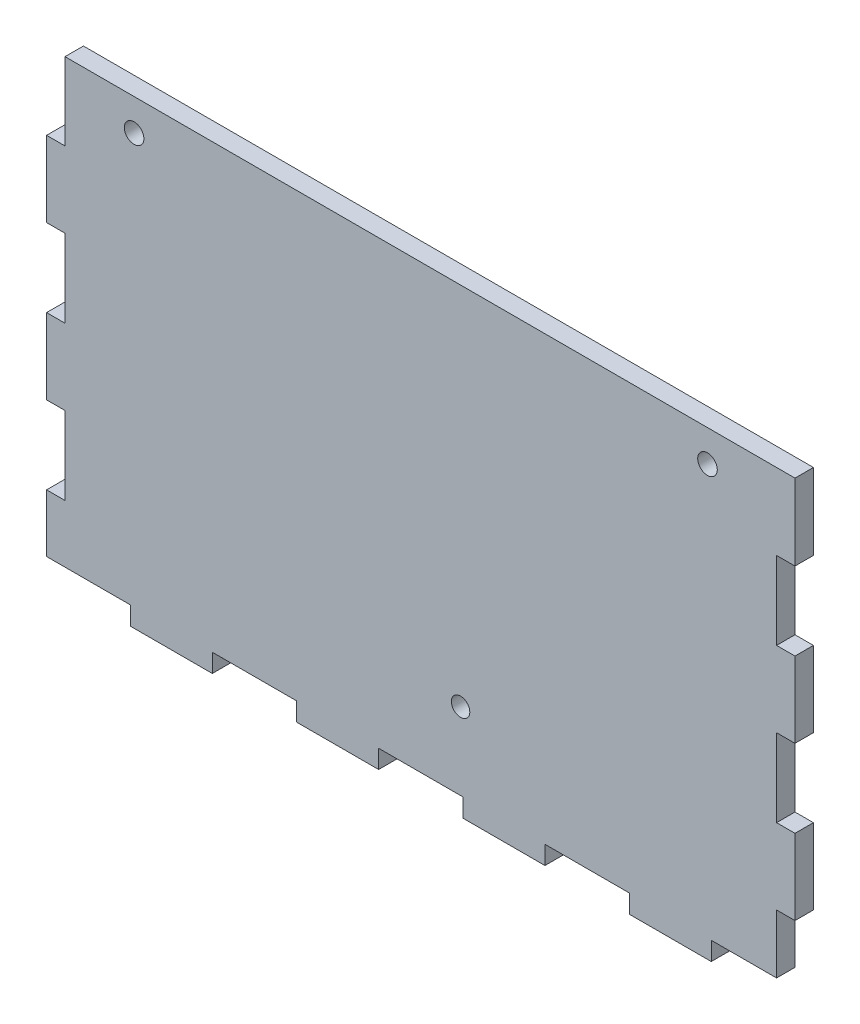
from build123d import *

# Parameters (mm, degrees)
SKETCH1_W                = 130
SKETCH1_H                = 80
BOSS_EXTRUDE1_DEPTH      = 3.2
SKETCH2_W                = 14.444444444
SKETCH2_H                = 3.2
SKETCH2_W_2              = 3.2
SKETCH2_H_2              = 13.333333334
SKETCH2_H_3              = 13.333333333
CUT_EXTRUDE1_DEPTH       = 153.676913775
CUT_EXTRUDE2_REACH       = 154.677
SKETCH3_R                = 1.7
TUNING_DRIVER_HOLE_REACH = 154.677
SKETCH4_R                = 1.6
WIDTH_TOLERANCE_BY       = 0.1
WIDTH_TOLERANCE_2_BY     = 0.1
WIDTH_TOLERANCE_3_BY     = 0.1
WIDTH_TOLERANCE_4_BY     = 0.1
WIDTH_TOLERANCE_5_BY     = 0.1
WIDTH_TOLERANCE_6_BY     = 0.1
WIDTH_TOLERANCE_7_BY     = 0.1
WIDTH_TOLERANCE_8_BY     = 0.1
WIDTH_TOLERANCE_9_BY     = 0.1
WIDTH_TOLERANCE_10_BY    = 0.1
WIDTH_TOLERANCE_11_BY    = 0.1
WIDTH_TOLERANCE_12_BY    = 0.1
WIDTH_TOLERANCE_13_BY    = 0.1
WIDTH_TOLERANCE_14_BY    = 0.1
WIDTH_TOLERANCE_15_BY    = 0.1
WIDTH_TOLERANCE_16_BY    = 0.1
WIDTH_TOLERANCE_17_BY    = 0.1
WIDTH_TOLERANCE_18_BY    = 0.1


with BuildPart() as part:
    # Sketch1 → Boss-Extrude1 (new body)
    with BuildSketch(Plane.XY):
        with Locations((65, 40)):
            Rectangle(SKETCH1_W, SKETCH1_H)
    extrude(amount=BOSS_EXTRUDE1_DEPTH)

    # Sketch2 → Cut-Extrude1 (cut, through all)
    with BuildSketch(Plane.XY.offset(3.2)):
        with Locations((7.222222222, 1.6)):
            Rectangle(SKETCH2_W, SKETCH2_H)
        with Locations((36.111111111, 1.6)):
            Rectangle(SKETCH2_W, SKETCH2_H)
        with Locations((65, 1.6)):
            Rectangle(SKETCH2_W, SKETCH2_H)
        with Locations((93.888888889, 1.6)):
            Rectangle(SKETCH2_W, SKETCH2_H)
        Polygon((115.555555556, 0), (115.555555556, 3.2), (126.8, 3.2), (126.8, 13.333333333), (130, 13.333333333), (130, 0), align=None)
        with Locations((1.6, 20)):
            Rectangle(SKETCH2_W_2, SKETCH2_H_2)
        with Locations((1.6, 46.666666667)):
            Rectangle(SKETCH2_W_2, SKETCH2_H_3)
        with Locations((1.6, 73.333333334)):
            Rectangle(SKETCH2_W_2, SKETCH2_H_3)
        with Locations((128.4, 33.333333334)):
            Rectangle(SKETCH2_W_2, SKETCH2_H_3)
        with Locations((128.4, 60)):
            Rectangle(SKETCH2_W_2, SKETCH2_H_2)
    extrude(amount=-CUT_EXTRUDE1_DEPTH, mode=Mode.SUBTRACT)

    # Sketch3 → Cut-Extrude2 (cut, up to next)
    with BuildSketch(Plane.XY.offset(3.2), mode=Mode.PRIVATE) as cut_extrude2_sk1:
        with Locations((15.2, 74.5)):
            Circle(SKETCH3_R)
    cut_extrude2_tool1 = extrude(cut_extrude2_sk1.sketch, amount=-CUT_EXTRUDE2_REACH, mode=Mode.PRIVATE) & part.part
    # Sketch3 → Cut-Extrude2 (cut, up to next)
    with BuildSketch(Plane.XY.offset(3.2), mode=Mode.PRIVATE) as cut_extrude2_sk2:
        with Locations((114.8, 74.5)):
            Circle(SKETCH3_R)
    cut_extrude2_tool2 = extrude(cut_extrude2_sk2.sketch, amount=-CUT_EXTRUDE2_REACH, mode=Mode.PRIVATE) & part.part
    add(cut_extrude2_tool1.solids().sort_by_distance((15.2, 74.5, 3.2))[0], mode=Mode.SUBTRACT)
    add(cut_extrude2_tool2.solids().sort_by_distance((114.8, 74.5, 3.2))[0], mode=Mode.SUBTRACT)

    # Sketch4 → Tuning driver hole (cut, up to next)
    with BuildSketch(Plane(origin=(0, 0, 0), x_dir=(-1, 0, 0), z_dir=(0, 0, -1)), mode=Mode.PRIVATE) as tuning_driver_hole_sk1:
        with Locations((-71.91, 16.56)):
            Circle(SKETCH4_R)
    tuning_driver_hole_tool1 = extrude(tuning_driver_hole_sk1.sketch, amount=-TUNING_DRIVER_HOLE_REACH, mode=Mode.PRIVATE) & part.part
    add(tuning_driver_hole_tool1.solids().sort_by_distance((71.91, 16.56, 0))[0], mode=Mode.SUBTRACT)

    # Width tolerance: a face moved inward by 0.1
    extrude(part.faces().sort_by_distance((128.4, 53.333333333, 1.6))[0], amount=WIDTH_TOLERANCE_BY, dir=(0, -1, 0), mode=Mode.SUBTRACT)

    # Width tolerance 2: a face moved inward by 0.1
    extrude(part.faces().sort_by_distance((128.4, 26.666666667, 1.6))[0], amount=WIDTH_TOLERANCE_2_BY, dir=(0, -1, 0), mode=Mode.SUBTRACT)

    # Width tolerance 3: a face moved inward by 0.1
    extrude(part.faces().sort_by_distance((128.4, 13.333333333, 1.6))[0], amount=WIDTH_TOLERANCE_3_BY, dir=(0, 1, 0), mode=Mode.SUBTRACT)

    # Width tolerance 4: a face moved inward by 0.1
    extrude(part.faces().sort_by_distance((128.4, 40, 1.6))[0], amount=WIDTH_TOLERANCE_4_BY, dir=(0, 1, 0), mode=Mode.SUBTRACT)

    # Width tolerance 5: a face moved inward by 0.1
    extrude(part.faces().sort_by_distance((128.4, 66.666666667, 1.6))[0], amount=WIDTH_TOLERANCE_5_BY, dir=(0, 1, 0), mode=Mode.SUBTRACT)

    # Width tolerance 6: a face moved inward by 0.1
    extrude(part.faces().sort_by_distance((115.555555556, 1.6, 1.6))[0], amount=WIDTH_TOLERANCE_6_BY, dir=(-1, 0, 0), mode=Mode.SUBTRACT)

    # Width tolerance 7: a face moved inward by 0.1
    extrude(part.faces().sort_by_distance((86.666666667, 1.6, 1.6))[0], amount=WIDTH_TOLERANCE_7_BY, dir=(-1, 0, 0), mode=Mode.SUBTRACT)

    # Width tolerance 8: a face moved inward by 0.1
    extrude(part.faces().sort_by_distance((57.777777778, 1.6, 1.6))[0], amount=WIDTH_TOLERANCE_8_BY, dir=(-1, 0, 0), mode=Mode.SUBTRACT)

    # Width tolerance 9: a face moved inward by 0.1
    extrude(part.faces().sort_by_distance((28.888888889, 1.6, 1.6))[0], amount=WIDTH_TOLERANCE_9_BY, dir=(-1, 0, 0), mode=Mode.SUBTRACT)

    # Width tolerance 10: a face moved inward by 0.1
    extrude(part.faces().sort_by_distance((14.444444444, 1.6, 1.6))[0], amount=WIDTH_TOLERANCE_10_BY, dir=(1, 0, 0), mode=Mode.SUBTRACT)

    # Width tolerance 11: a face moved inward by 0.1
    extrude(part.faces().sort_by_distance((43.333333333, 1.6, 1.6))[0], amount=WIDTH_TOLERANCE_11_BY, dir=(1, 0, 0), mode=Mode.SUBTRACT)

    # Width tolerance 12: a face moved inward by 0.1
    extrude(part.faces().sort_by_distance((72.222222222, 1.6, 1.6))[0], amount=WIDTH_TOLERANCE_12_BY, dir=(1, 0, 0), mode=Mode.SUBTRACT)

    # Width tolerance 13: a face moved inward by 0.1
    extrude(part.faces().sort_by_distance((101.111111111, 1.6, 1.6))[0], amount=WIDTH_TOLERANCE_13_BY, dir=(1, 0, 0), mode=Mode.SUBTRACT)

    # Width tolerance 14: a face moved inward by 0.1
    extrude(part.faces().sort_by_distance((1.6, 26.666666667, 1.6))[0], amount=WIDTH_TOLERANCE_14_BY, dir=(0, 1, 0), mode=Mode.SUBTRACT)

    # Width tolerance 15: a face moved inward by 0.1
    extrude(part.faces().sort_by_distance((1.6, 13.333333333, 1.6))[0], amount=WIDTH_TOLERANCE_15_BY, dir=(0, -1, 0), mode=Mode.SUBTRACT)

    # Width tolerance 16: a face moved inward by 0.1
    extrude(part.faces().sort_by_distance((1.6, 40, 1.6))[0], amount=WIDTH_TOLERANCE_16_BY, dir=(0, -1, 0), mode=Mode.SUBTRACT)

    # Width tolerance 17: a face moved inward by 0.1
    extrude(part.faces().sort_by_distance((1.6, 53.333333333, 1.6))[0], amount=WIDTH_TOLERANCE_17_BY, dir=(0, 1, 0), mode=Mode.SUBTRACT)

    # Width tolerance 18: a face moved inward by 0.1
    extrude(part.faces().sort_by_distance((1.6, 66.666666667, 1.6))[0], amount=WIDTH_TOLERANCE_18_BY, dir=(0, -1, 0), mode=Mode.SUBTRACT)


solid = part.part
